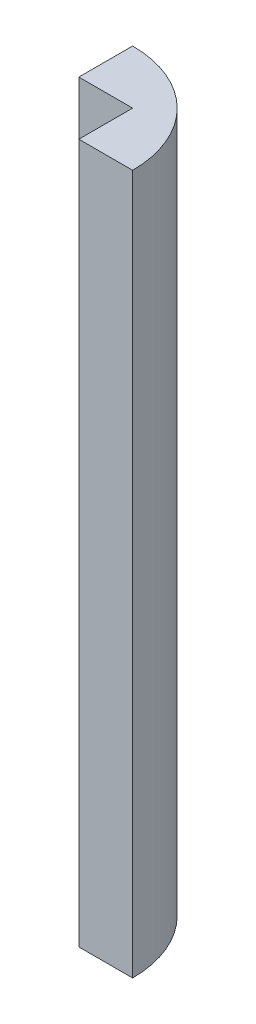
from build123d import *

# Parameters (mm, degrees)
BOSS_EXTRUDE1_DEPTH = 130


with BuildPart() as part:
    # Sketch1 → Boss-Extrude1 (new body)
    with BuildSketch(Plane(origin=(0, 0, 0), x_dir=(1, 0, 0), z_dir=(0, 1, 0))):
        with BuildLine():
            Line((10, 0), (20, 0))
            ThreePointArc((20, 0), (14.142135624, 14.142135624), (0, 20))
            Line((0, 20), (0, 10))
            Line((0, 10), (10, 10))
            Line((10, 10), (10, 0))
        make_face()
    extrude(amount=BOSS_EXTRUDE1_DEPTH)


solid = part.part
